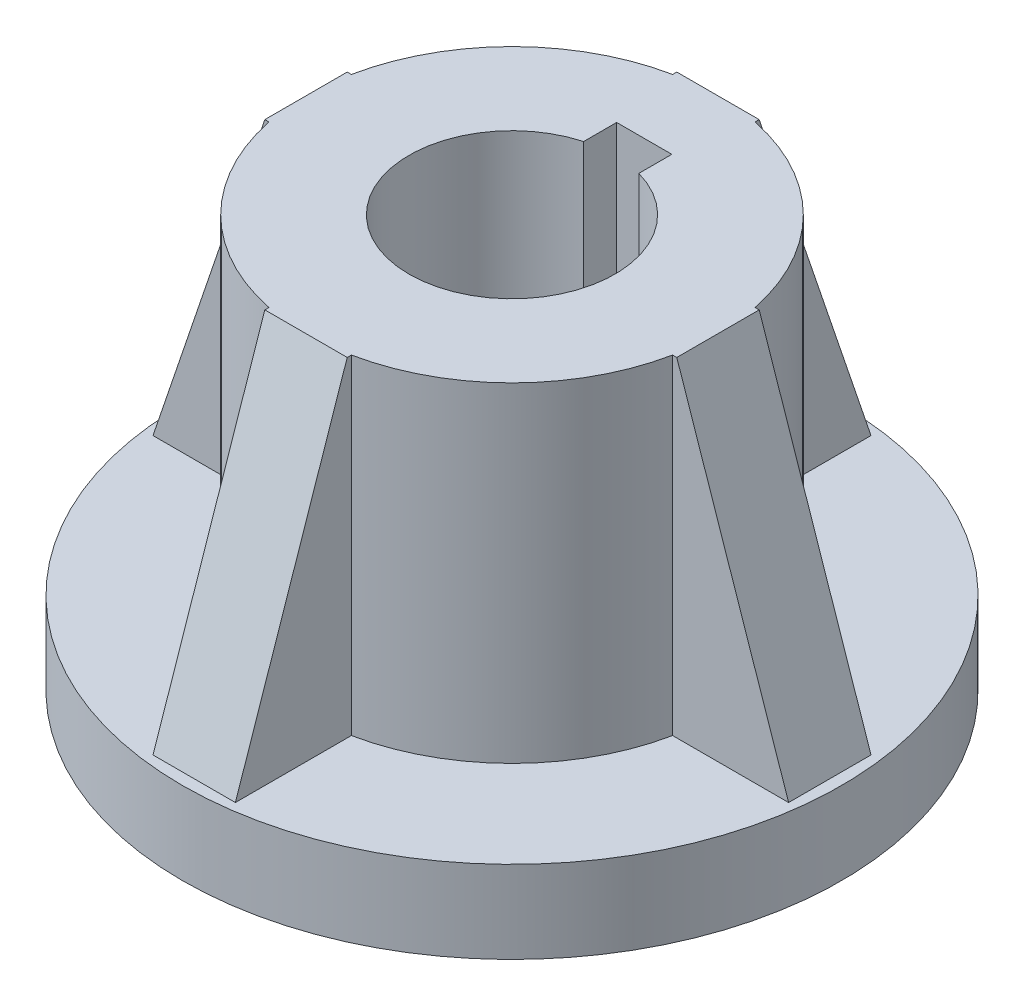
from build123d import *

# Parameters (mm, degrees)
SCHIZZO1_R                   = 40
ESTRUSIONE_ESTRUSIONE1_DEPTH = 10
SCHIZZO2_R                   = 25
ESTRUSIONE_ESTRUSIONE2_DEPTH = 40
TAGLIO_ESTRUSIONE1_DEPTH     = 40
NERVATURA16_START            = -5
NERVATURA16_DEPTH            = 10
RIPETIZIONECIRCOLARE1_COUNT  = 4


with BuildPart() as part:
    # Schizzo1 → Estrusione-Estrusione1 (new body)
    with BuildSketch(Plane(origin=(0, 0, 0), x_dir=(1, 0, 0), z_dir=(0, 1, 0))):
        with Locations(Location((0, 0, 0), (0, 0, 270))):
            Circle(SCHIZZO1_R)
    extrude(amount=ESTRUSIONE_ESTRUSIONE1_DEPTH)

    # Schizzo2 → Estrusione-Estrusione2 (add)
    with BuildSketch(Plane(origin=(0, 10, 0), x_dir=(1, 0, 0), z_dir=(0, 1, 0))):
        with Locations(Location((0, 0, 0), (0, 0, 270))):
            Circle(SCHIZZO2_R)
    extrude(amount=ESTRUSIONE_ESTRUSIONE2_DEPTH)

    # Schizzo3 → Taglio-Estrusione1 (cut)
    with BuildSketch(Plane(origin=(0, 50, 0), x_dir=(1, 0, 0), z_dir=(0, 1, 0))):
        with BuildLine():
            Line((-3.349661481, 12.042830563), (-3.349661481, 16.050123743))
            Line((-3.349661481, 16.050123743), (3.349661481, 16.050123743))
            Line((3.349661481, 16.050123743), (3.349661481, 12.042830563))
            ThreePointArc((3.349661481, 12.042830563), (0, -12.5), (-3.349661481, 12.042830563))
        make_face()
    extrude(amount=-TAGLIO_ESTRUSIONE1_DEPTH, mode=Mode.SUBTRACT)

    # Nervatura16: read off the stored shape, not the designer's step
    # Nervatura16 outline → Nervatura16 (add)
    with BuildSketch(Plane(origin=(0, 0, 0), x_dir=(0, 0, -1), z_dir=(1, 0, 0)).offset(NERVATURA16_START)):
        Polygon((-24.494897428, 50), (-25, 50), (-38.573669022, 10), (-24.494897428, 10), align=None)
    nervatura16 = extrude(amount=NERVATURA16_DEPTH)

    # RipetizioneCircolare1: Nervatura16 ×4 about axis
    ripetizionecircolare1_axis = Axis((0, 0, 0), (0, 1, 0))
    for i in range(1, RIPETIZIONECIRCOLARE1_COUNT):
        add(nervatura16.rotate(ripetizionecircolare1_axis, i * 360 / RIPETIZIONECIRCOLARE1_COUNT))


solid = part.part
